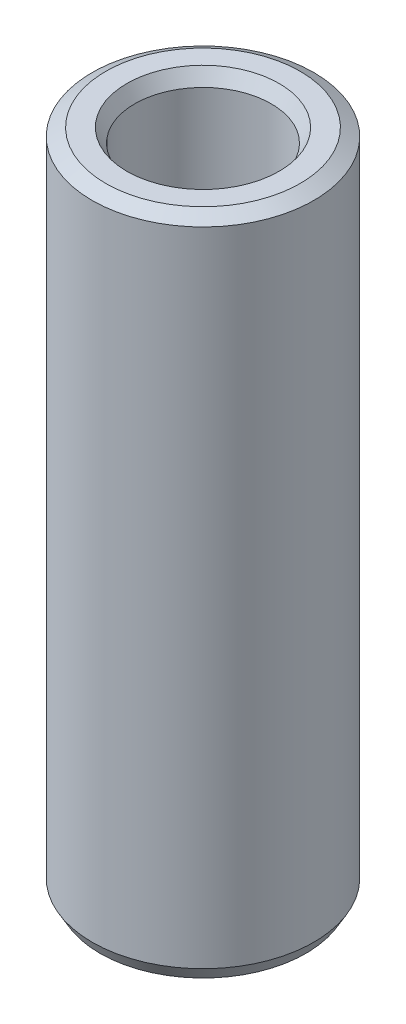
from build123d import *
from OCP.BRepFilletAPI import BRepFilletAPI_MakeChamfer

# Parameters (mm, degrees)
SKETCH1_R           = 47.5
BOSS_EXTRUDE1_DEPTH = 284.488386565
SKETCH2_R           = 29.245542002
CUT_EXTRUDE1_DEPTH  = 293.311720755
CHAMFER1_SIZE       = 3.376395086
CHAMFER1_SIZE2      = 5.848087835


with BuildPart() as part:
    # Sketch1 → Boss-Extrude1 (new body)
    with BuildSketch(Plane(origin=(0, 0, 0), x_dir=(1, 0, 0), z_dir=(0, 1, 0))):
        Circle(SKETCH1_R)
    extrude(amount=BOSS_EXTRUDE1_DEPTH)

    # Sketch2 → Cut-Extrude1 (cut, through all)
    with BuildSketch(Plane(origin=(0, 0, 0), x_dir=(1, 0, 0), z_dir=(0, 1, 0))):
        Circle(SKETCH2_R)
    extrude(amount=CUT_EXTRUDE1_DEPTH, mode=Mode.SUBTRACT)

    # Chamfer1: one chamfer whose edges measure the first distance from different faces: ONE call of the kernel's chamfer builder (chamfer() names one face for all edges)
    chamfer1_edges_1 = [part.edges().sort_by_distance(p)[0] for p in [
        (-29.245542002, 284.488386565, 0),
    ]]
    chamfer1_side_1 = [part.faces().sort_by_distance(p)[0] for p in [
        (-46.156497116, 284.488386565, 0),
    ]]
    chamfer1_edges_2 = [part.edges().sort_by_distance(p)[0] for p in [
        (-29.245542002, 0, 0),
    ]]
    chamfer1_side_2 = [part.faces().sort_by_distance(p)[0] for p in [
        (-29.245542002, 142.244193283, 0),
    ]]
    chamfer1_edges_3 = [part.edges().sort_by_distance(p)[0] for p in [
        (-47.5, 0, 0),
    ]]
    chamfer1_side_3 = [part.faces().sort_by_distance(p)[0] for p in [
        (-46.156497116, 0, 0),
    ]]
    chamfer1_edges_4 = [part.edges().sort_by_distance(p)[0] for p in [
        (-47.5, 284.488386565, 0),
    ]]
    chamfer1_side_4 = [part.faces().sort_by_distance(p)[0] for p in [
        (-47.5, 142.244193283, 0),
    ]]
    chamfer1 = BRepFilletAPI_MakeChamfer(part.part.solid().wrapped)
    for e in chamfer1_edges_1:
        chamfer1.Add(CHAMFER1_SIZE, CHAMFER1_SIZE2, e.wrapped, chamfer1_side_1[0].wrapped)  # the first distance lies on this face
    for e in chamfer1_edges_2:
        chamfer1.Add(CHAMFER1_SIZE, CHAMFER1_SIZE2, e.wrapped, chamfer1_side_2[0].wrapped)  # the first distance lies on this face
    for e in chamfer1_edges_3:
        chamfer1.Add(CHAMFER1_SIZE, CHAMFER1_SIZE2, e.wrapped, chamfer1_side_3[0].wrapped)  # the first distance lies on this face
    for e in chamfer1_edges_4:
        chamfer1.Add(CHAMFER1_SIZE, CHAMFER1_SIZE2, e.wrapped, chamfer1_side_4[0].wrapped)  # the first distance lies on this face
    add(Compound.cast(chamfer1.Shape()), mode=Mode.REPLACE)


solid = part.part
